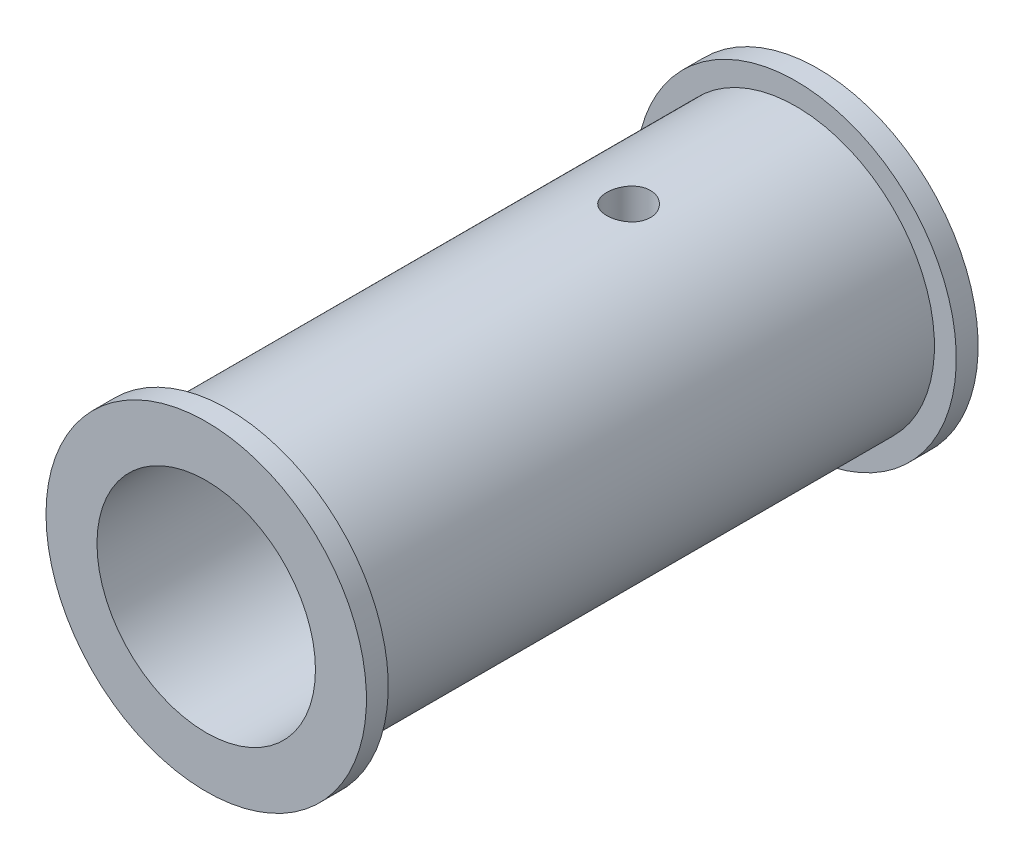
from build123d import *

# Parameters (mm, degrees)
CORTAR_EXTRUIR1_DEPTH = 38.389838192
CROQUIS3_W            = 5.6
CROQUIS3_H            = 2.5
CORTAR_EXTRUIR2_DEPTH = 8
CROQUIS4_R            = 1.5
CORTAR_EXTRUIR3_DEPTH = 29.600699292


with BuildPart() as part:
    # Croquis1 → Revolución1 (revolve)
    with BuildSketch(Plane(origin=(0, 0, 0), x_dir=(0, 0, -1), z_dir=(1, 0, 0))):
        Polygon((-24, 7.5), (-24, 11), (-22.5, 11), (-22.5, 9.5), (16.5, 9.5), (16.5, 11), (18, 11), (18, 8), (10, 8), (10, 0), (0, 0), (0, 7.5), align=None)
    revolve(axis=Axis((0, 0, 0), (0, 0, 1)))

    # Croquis2 → Cortar-Extruir1 (cut, through all)
    with BuildSketch(Plane(origin=(0, 0, -10), x_dir=(-1, 0, 0), z_dir=(0, 0, -1))):
        with BuildLine():
            Line((-1.118033989, 1), (1.118033989, 1))
            ThreePointArc((1.118033989, 1), (0, -1.5), (-1.118033989, 1))
        make_face()
    extrude(amount=-CORTAR_EXTRUIR1_DEPTH, mode=Mode.SUBTRACT)

    # Croquis3 → Cortar-Extruir2 (cut)
    with BuildSketch(Plane(origin=(0, 0, -10), x_dir=(-1, 0, 0), z_dir=(0, 0, -1))):
        with Locations((0, 3.25)):
            Rectangle(CROQUIS3_W, CROQUIS3_H)
    extrude(amount=-CORTAR_EXTRUIR2_DEPTH, mode=Mode.SUBTRACT)

    # Croquis4 → Cortar-Extruir3 (cut, through all)
    with BuildSketch(Plane(origin=(0, 0, 0), x_dir=(1, 0, 0), z_dir=(0, 1, 0))):
        with Locations((0, 5)):
            Circle(CROQUIS4_R)
    extrude(amount=CORTAR_EXTRUIR3_DEPTH, mode=Mode.SUBTRACT)


solid = part.part
